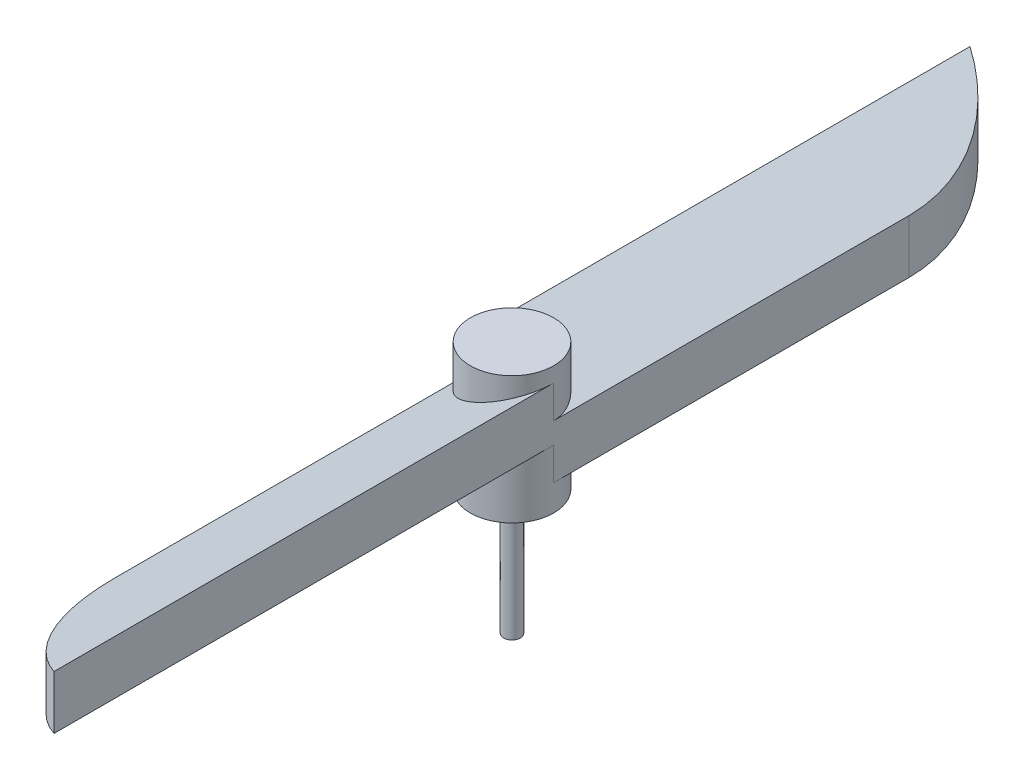
from build123d import *

# Parameters (mm, degrees)
SKETCH2_R                = 2.5
BOSS_EXTRUDE1_DEPTH      = 100
BOSS_EXTRUDE2_DEPTH      = 200
CUT_EXTRUDE5_START       = 60.350129398
CUT_EXTRUDE5_DEPTH       = 39.299741204
CIRPATTERN2_COUNT        = 2
CUT_EXTRUDE13_START      = 60.350129398
CUT_EXTRUDE13_DEPTH      = 39.299741204
FILLET1_R                = 10
FILLET2_R                = 10
CUT_EXTRUDE14_DEPTH      = 105.432992871
CUT_EXTRUDE14_DEPTH_BACK = 105.432992871
SKETCH14_W               = 44.068346903
SKETCH14_H               = 27.8913588
CUT_EXTRUDE15_DEPTH      = 91.768685539
CUT_EXTRUDE15_DEPTH_BACK = 91.768685539
SKETCH15_W               = 22.136968411
SKETCH15_H               = 5.24183176
CUT_EXTRUDE16_DEPTH      = 89.750452329
CUT_EXTRUDE16_DEPTH_BACK = 89.750452329
SKETCH16_W               = 11.028183549
SKETCH16_H               = 76.248198314
CUT_EXTRUDE17_DEPTH      = 89.750452329
CUT_EXTRUDE17_DEPTH_BACK = 89.750452329
SKETCH19_W               = 10.280501296
SKETCH19_H               = 4.008748932
SKETCH20_R               = 0.5
BOSS_EXTRUDE3_DEPTH      = 7.5


# Read off the part's stored shape, not the designer's step: Cut-Extrude5, Cut-Extrude13
with BuildPart() as part:
    # Sketch2 → Boss-Extrude1 (new body)
    with BuildSketch(Plane(origin=(0, 0, 0), x_dir=(1, 0, 0), z_dir=(0, 1, 0))):
        with Locations(Location((0, 0, 0), (0, 0, 270))):
            Circle(SKETCH2_R)
    extrude(amount=BOSS_EXTRUDE1_DEPTH)

    # Sketch3 → Boss-Extrude2 (add)
    with BuildSketch(Plane.XY):
        Polygon((47.096645081, 63.143071984), (-46.001441122, 99.649870602), (-47.096645081, 96.856928016), (46.001441122, 60.350129398), align=None)
    boss_extrude2 = extrude(amount=-BOSS_EXTRUDE2_DEPTH)

    # Cut-Extrude5 outline → Cut-Extrude5 (cut)
    with BuildSketch(Plane(origin=(0, 0, 0), x_dir=(1, 0, 0), z_dir=(0, 1, 0)).offset(CUT_EXTRUDE5_START)):
        Polygon((-2.5, 0), (-2.5, 30), (2.5, 30), (2.5, 0), (49, 0), (49, 200), (-49, 200), (-49, 0), align=None)
    extrude(amount=CUT_EXTRUDE5_DEPTH, mode=Mode.SUBTRACT)

    # CirPattern2: Boss-Extrude2 ×2 about axis
    cirpattern2_axis = Axis((0, 100, 0), (0, -1, 0))
    for i in range(1, CIRPATTERN2_COUNT):
        add(boss_extrude2.rotate(cirpattern2_axis, i * 360 / CIRPATTERN2_COUNT))

    # Cut-Extrude13 outline → Cut-Extrude13 (cut)
    with BuildSketch(Plane(origin=(0, 0, 0), x_dir=(1, 0, 0), z_dir=(0, 1, 0)).offset(CUT_EXTRUDE13_START)):
        Polygon((-2.5, -30), (-2.5, 0), (-49, 0), (-49, -200), (49, -200), (49, 0), (2.5, 0), (2.5, -30), align=None)
    extrude(amount=CUT_EXTRUDE13_DEPTH, mode=Mode.SUBTRACT)

    # Fillet1
    # the kernel refuses this fillet: 10 mm, written as the material it takes off along each edge
    with BuildSketch(Plane(origin=(2.5, 55.757829393, -30), x_dir=(0, 0, 1), z_dir=(0, 1, 0))) as fillet1_piece_1:
        with BuildLine():
            CenterArc((8.660254038, -10), FILLET1_R, 90, 60)
            Line((0, -5), (-0.173205081, -4.9))
            ThreePointArc((-0.173205081, -4.9), (-0.2, -2.5), (-0.2, 0))
            Line((-0.2, 0), (0, 0.2))
            Line((0, 0.2), (8.660254038, 0.2))
            Line((8.660254038, 0.2), (8.660254038, 0))
        make_face()
    extrude(amount=46.523677998, mode=Mode.SUBTRACT)

    # Fillet2
    # the kernel refuses this fillet: 10 mm, written as the material it takes off along each edge
    with BuildSketch(Plane(origin=(-2.5, 55.757829393, 30), x_dir=(0, 0, -1), z_dir=(0, 1, 0))) as fillet2_piece_1:
        with BuildLine():
            CenterArc((8.660254038, -10), FILLET2_R, 90, 60)
            Line((0, -5), (-0.173205081, -4.9))
            ThreePointArc((-0.173205081, -4.9), (-0.2, -2.5), (-0.2, 0))
            Line((-0.2, 0), (0, 0.2))
            Line((0, 0.2), (8.660254038, 0.2))
            Line((8.660254038, 0.2), (8.660254038, 0))
        make_face()
    extrude(amount=46.523677998, mode=Mode.SUBTRACT)

    # Sketch14 → Cut-Extrude14 (cut, two sides: drawn at the far end of the back side and taken through both)
    with BuildSketch(Plane(origin=(0, 0, 0), x_dir=(0, 0, -1), z_dir=(1, 0, 0)).offset(-CUT_EXTRUDE14_DEPTH_BACK)):
        with Locations((-11.714370696, 99.576890266)):
            Rectangle(SKETCH14_W, SKETCH14_H)
    extrude(amount=CUT_EXTRUDE14_DEPTH + CUT_EXTRUDE14_DEPTH_BACK, mode=Mode.SUBTRACT)

    # Sketch15 → Cut-Extrude15 (cut, two sides: drawn at the far end of the back side and taken through both)
    with BuildSketch(Plane(origin=(0, 0, 0), x_dir=(0, 0, -1), z_dir=(1, 0, 0)).offset(-CUT_EXTRUDE15_DEPTH_BACK)):
        with Locations((-5.158121646, 86.109794113)):
            Rectangle(SKETCH15_W, SKETCH15_H)
    extrude(amount=CUT_EXTRUDE15_DEPTH + CUT_EXTRUDE15_DEPTH_BACK, mode=Mode.SUBTRACT)

    # Sketch16 → Cut-Extrude16 (cut, two sides: drawn at the far end of the back side and taken through both)
    with BuildSketch(Plane(origin=(0, 0, 0), x_dir=(0, 0, -1), z_dir=(1, 0, 0)).offset(-CUT_EXTRUDE16_DEPTH_BACK)):
        with Locations((1.378247022, 35.930712441)):
            Rectangle(SKETCH16_W, SKETCH16_H)
    extrude(amount=CUT_EXTRUDE16_DEPTH + CUT_EXTRUDE16_DEPTH_BACK, mode=Mode.SUBTRACT)

    # Sketch19 → Cut-Extrude17 (cut, two sides: drawn at the far end of the back side and taken through both)
    with BuildSketch(Plane(origin=(0, 0, 0), x_dir=(0, 0, -1), z_dir=(1, 0, 0)).offset(-CUT_EXTRUDE17_DEPTH_BACK)):
        with Locations((0.096985861, 73.82556599)):
            Rectangle(SKETCH19_W, SKETCH19_H)
    extrude(amount=CUT_EXTRUDE17_DEPTH + CUT_EXTRUDE17_DEPTH_BACK, mode=Mode.SUBTRACT)

    # Sketch20 → Boss-Extrude3 (add)
    with BuildSketch(Plane.XZ.offset(-75.829940456)):
        with Locations(Location((0, 0, 0), (0, 0, 270))):
            Circle(SKETCH20_R)
    extrude(amount=BOSS_EXTRUDE3_DEPTH)


solid = part.part
